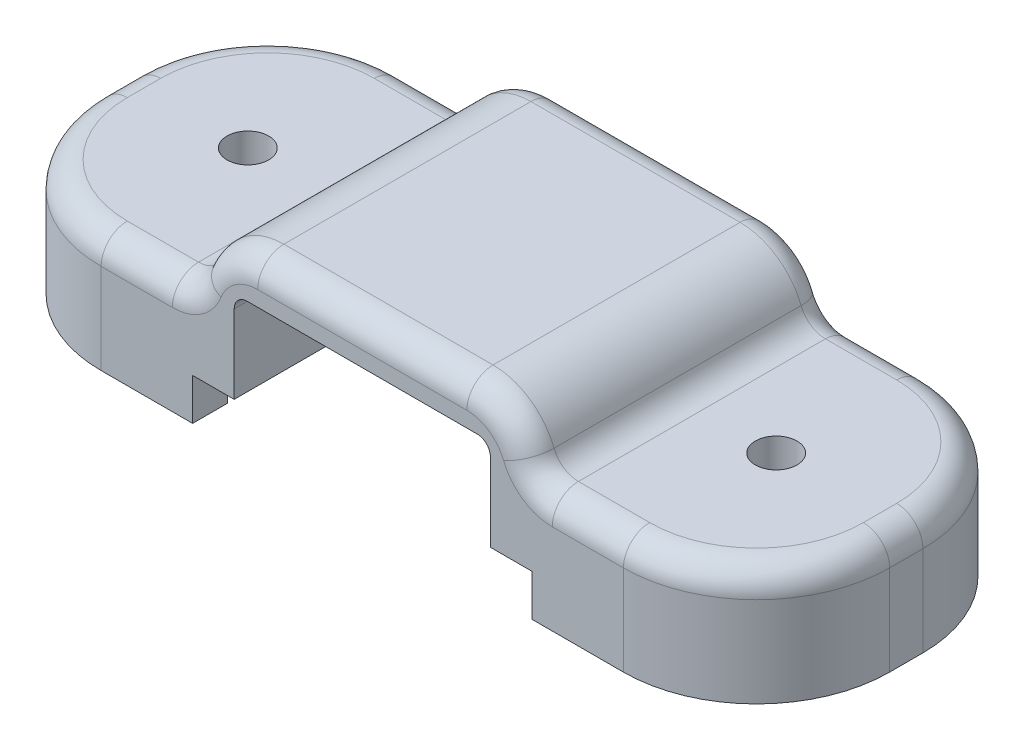
from build123d import *

# Parameters (mm, degrees)
BOSS_EXTRUDE1_DEPTH = 22.86
SKETCH2_W           = 22.86
SKETCH2_H           = 5.715
SKETCH2_H_2         = 3.175
BOSS_EXTRUDE2_DEPTH = 17.145
SKETCH3_W           = 22.86
SKETCH3_H           = 5.715
SKETCH3_H_2         = 3.175
BOSS_EXTRUDE3_DEPTH = 17.145
SKETCH4_W           = 17.51
SKETCH4_H           = 3.175
CUT_EXTRUDE1_DEPTH  = 13.97
SKETCH5_W           = 17.51
SKETCH5_H           = 3.175
CUT_EXTRUDE2_DEPTH  = 13.97
SKETCH6_R           = 1.5875
CUT_EXTRUDE3_DEPTH  = 8.89
FILLET1_R           = 8.255
FILLET2_R           = 10.16
FILLET3_R           = 1
FILLET4_R           = 5
FILLET5_R           = 2


with BuildPart() as part:
    # Sketch1 → Boss-Extrude1 (new body)
    with BuildSketch(Plane.XY):
        Polygon((22.733, 17.145), (9.779, 17.145), (9.779, 13.97), (19.558, 13.97), (19.558, 6.985), (22.733, 6.985), align=None)
        Polygon((9.779, 13.97), (9.779, 17.145), (-3.175, 17.145), (-3.175, 6.985), (0, 6.985), (0, 13.97), align=None)
    extrude(amount=BOSS_EXTRUDE1_DEPTH)

    # Sketch2 → Boss-Extrude2 (add)
    with BuildSketch(Plane.ZY.offset(3.175)):
        with Locations((11.43, 9.8425)):
            Rectangle(SKETCH2_W, SKETCH2_H)
        with Locations((11.43, 5.3975)):
            Rectangle(SKETCH2_W, SKETCH2_H_2)
    extrude(amount=BOSS_EXTRUDE2_DEPTH)

    # Sketch3 → Boss-Extrude3 (add)
    with BuildSketch(Plane(origin=(22.733, 0, 0), x_dir=(0, 0, -1), z_dir=(1, 0, 0))):
        with Locations((-11.43, 9.8425)):
            Rectangle(SKETCH3_W, SKETCH3_H)
        with Locations((-11.43, 5.3975)):
            Rectangle(SKETCH3_W, SKETCH3_H_2)
    extrude(amount=BOSS_EXTRUDE3_DEPTH)

    # Sketch4 → Cut-Extrude1 (cut)
    with BuildSketch(Plane.ZY.offset(-22.733)):
        with Locations((11.43, 5.3975)):
            Rectangle(SKETCH4_W, SKETCH4_H)
    extrude(amount=-CUT_EXTRUDE1_DEPTH, mode=Mode.SUBTRACT)

    # Sketch5 → Cut-Extrude2 (cut)
    with BuildSketch(Plane(origin=(-3.175, 0, 0), x_dir=(0, 0, -1), z_dir=(1, 0, 0))):
        with Locations((-11.43, 5.3975)):
            Rectangle(SKETCH5_W, SKETCH5_H)
    extrude(amount=-CUT_EXTRUDE2_DEPTH, mode=Mode.SUBTRACT)

    # Sketch6 → Cut-Extrude3 (cut)
    with BuildSketch(Plane(origin=(0, 12.7, 0), x_dir=(1, 0, 0), z_dir=(0, 1, 0))):
        with Locations(Location((29.9466, -11.43, 0), (0, 0, 270))):
            Circle(SKETCH6_R)
        with Locations(Location((-10.3886, -11.43, 0), (0, 0, 270))):
            Circle(SKETCH6_R)
    extrude(amount=-CUT_EXTRUDE3_DEPTH, mode=Mode.SUBTRACT)

    # Fillet1
    fillet1_edges = [part.edges().sort_by_distance(p)[0] for p in [
        (36.703, 5.3975, 2.675),
        (36.703, 5.3975, 20.185),
        (-17.145, 5.3975, 20.185),
        (-17.145, 5.3975, 2.675),
    ]]
    fillet(fillet1_edges, radius=FILLET1_R)

    # Fillet2
    fillet2_edges = [part.edges().sort_by_distance(p)[0] for p in [
        (-20.32, 8.255, 22.86),
        (-20.32, 8.255, 0),
        (39.878, 8.255, 22.86),
        (39.878, 8.255, 0),
    ]]
    fillet(fillet2_edges, radius=FILLET2_R)

    # Fillet3
    fillet3_edges = [part.edges().sort_by_distance(p)[0] for p in [
        (19.558, 13.97, 11.43),
        (0, 13.97, 11.43),
    ]]
    fillet(fillet3_edges, radius=FILLET3_R)

    # Fillet4
    # the kernel refuses this fillet: 5 mm, written as the material it takes off along each edge
    with BuildSketch(Plane(origin=(22.733, 17.145, -12.422755079), x_dir=(-1, 0, 0), z_dir=(0, 0, 1))) as fillet4_piece_1:
        with BuildLine():
            CenterArc((4.969102032, 5), FILLET4_R, 186.372964386, 83.627035614)
            Line((0, 4.445), (-0.099382041, 4.4339))
            ThreePointArc((-0.099382041, 4.4339), (-0.1, 2.2225), (-0.1, 0))
            Line((-0.1, 0), (0, -0.1))
            Line((0, -0.1), (4.969102032, -0.1))
            Line((4.969102032, -0.1), (4.969102032, 0))
        make_face()
    extrude(amount=47.705510158, mode=Mode.SUBTRACT)
    with BuildSketch(Plane(origin=(-3.175, 17.145, -12.422755079), x_dir=(0, -1, 0), z_dir=(0, 0, 1))) as fillet4_piece_2:
        with BuildLine():
            CenterArc((5, 4.969102032), FILLET4_R, 180, 83.627035614)
            Line((0, 4.969102032), (-0.1, 4.969102032))
            Line((-0.1, 4.969102032), (-0.1, 0))
            Line((-0.1, 0), (0, -0.1))
            ThreePointArc((0, -0.1), (2.2225, -0.1), (4.4339, -0.099382041))
            Line((4.4339, -0.099382041), (4.445, 0))
        make_face()
    extrude(amount=47.705510158, mode=Mode.SUBTRACT)

    # Fillet5
    fillet5_edges = [part.edges().sort_by_distance(p)[0] for p in [
        (-20.32, 12.7, 11.43),
        (-6.6675, 12.7, 0),
        (-6.6675, 12.7, 22.86),
        (-17.344204897, 12.7, 2.975795103),
        (-17.344204897, 12.7, 19.884204897),
        (26.2255, 12.7, 22.86),
        (26.2255, 12.7, 0),
        (39.878, 12.7, 11.43),
        (36.902204897, 12.7, 2.975795103),
        (36.902204897, 12.7, 19.884204897),
        (9.779, 17.145, 0),
        (9.779, 17.145, 22.86),
        (-1.539439629, 15.871593619, 0),
        (21.097439629, 15.871593619, 0),
        (-1.539439629, 15.871593619, 22.86),
        (21.097439629, 15.871593619, 22.86),
        (-3.175, 12.7, 11.43),
        (22.733, 12.7, 11.43),
    ]]
    fillet(fillet5_edges, radius=FILLET5_R)


solid = part.part
